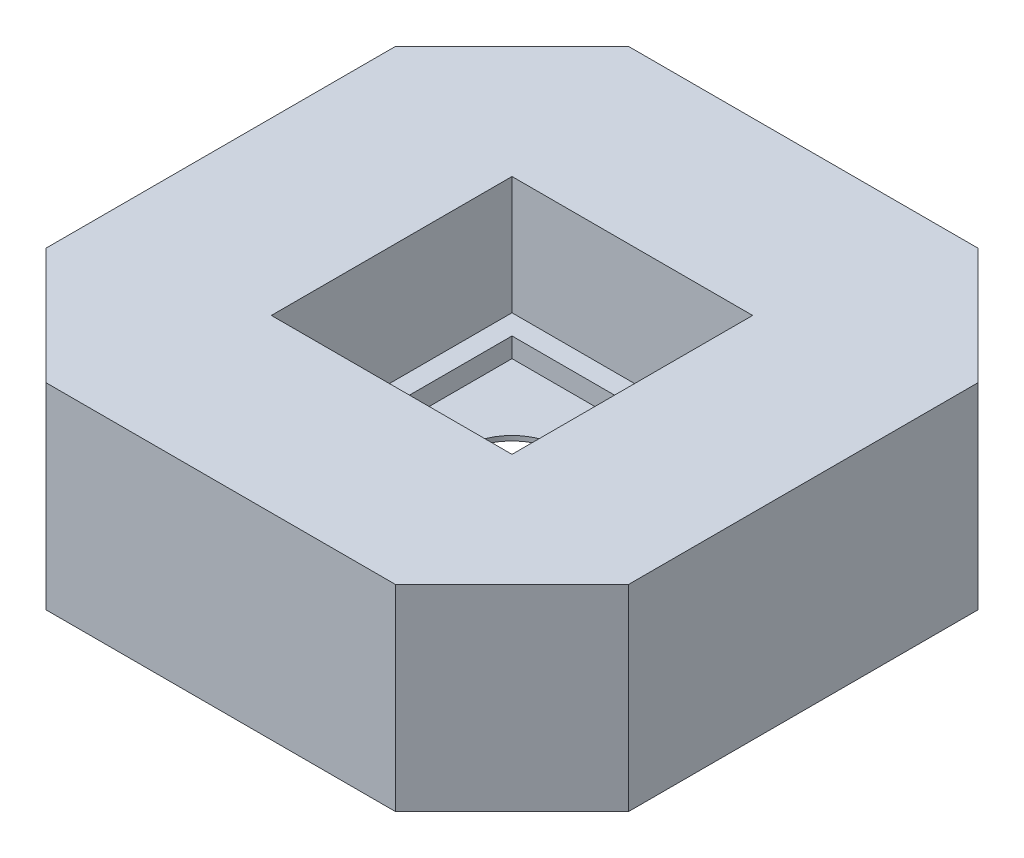
from build123d import *

# Parameters (mm, degrees)
EXTRUDE_1_DEPTH                    = 206
SKETCH_2_W                         = 252
SKETCH_2_H                         = 252
CUT_EXTRUDE_1_DEPTH                = 123.6
SKETCH_3_W                         = 210
SKETCH_3_H                         = 210
CUT_EXTRUDE_2_DEPTH                = 144.2
SHELL_1_T                          = -5
SKETCH_4_R                         = 50
CUT_EXTRUDE_3_DEPTH                = 455.80065963
RIB_1_REACH                        = 542.993
SKETCH_5_WALL_W                    = 1255.59277199
SKETCH_5_WALL_H                    = 10
PATTERN_CIRCULAR_1_COPY_1_REACH    = 542.993
PATTERN_CIRCULAR_1_COPY_1_SKETCH_W = 1255.59277199
PATTERN_CIRCULAR_1_COPY_1_SKETCH_H = 10
PATTERN_CIRCULAR_1_COPY_2_REACH    = 542.993
PATTERN_CIRCULAR_1_COPY_2_SKETCH_W = 1255.59277199
PATTERN_CIRCULAR_1_COPY_2_SKETCH_H = 10
PATTERN_CIRCULAR_1_COPY_3_REACH    = 542.993
PATTERN_CIRCULAR_1_COPY_3_SKETCH_W = 1255.59277199
PATTERN_CIRCULAR_1_COPY_3_SKETCH_H = 10
PATTERN_CIRCULAR_1_COPY_4_REACH    = 542.993
PATTERN_CIRCULAR_1_COPY_4_SKETCH_W = 1255.59277199
PATTERN_CIRCULAR_1_COPY_4_SKETCH_H = 10
PATTERN_CIRCULAR_1_COPY_5_REACH    = 542.993
PATTERN_CIRCULAR_1_COPY_5_SKETCH_W = 1255.59277199
PATTERN_CIRCULAR_1_COPY_5_SKETCH_H = 10
PATTERN_CIRCULAR_1_COPY_6_REACH    = 542.993
PATTERN_CIRCULAR_1_COPY_6_SKETCH_W = 1255.59277199
PATTERN_CIRCULAR_1_COPY_6_SKETCH_H = 10


with BuildPart() as part:
    # 草图1 → 凸台-拉伸1 (new body)
    with BuildSketch(Plane(origin=(0, 0, 0), x_dir=(1, 0, 0), z_dir=(0, 1, 0))):
        Polygon((-305, 183), (-183, 305), (183, 305), (305, 183), (305, -183), (183, -305), (-183, -305), (-305, -183), align=None)
    extrude(amount=EXTRUDE_1_DEPTH)

    # 草图2 → 切除-拉伸1 (cut)
    with BuildSketch(Plane(origin=(0, 206, 0), x_dir=(1, 0, 0), z_dir=(0, 1, 0))):
        Rectangle(SKETCH_2_W, SKETCH_2_H)
    extrude(amount=-CUT_EXTRUDE_1_DEPTH, mode=Mode.SUBTRACT)

    # 草图3 → 切除-拉伸2 (cut)
    with BuildSketch(Plane(origin=(0, 206, 0), x_dir=(1, 0, 0), z_dir=(0, 1, 0))):
        Rectangle(SKETCH_3_W, SKETCH_3_H)
    extrude(amount=-CUT_EXTRUDE_2_DEPTH, mode=Mode.SUBTRACT)

    # 抽壳1
    shell_1_openings = [part.faces().sort_by_distance(p)[0] for p in [
        (0, 0, 0),
    ]]
    offset(amount=SHELL_1_T, openings=shell_1_openings, kind=Kind.INTERSECTION)

    # 草图4 → 切除-拉伸3 (cut, through all)
    with BuildSketch(Plane(origin=(0, 61.8, 0), x_dir=(1, 0, 0), z_dir=(0, 1, 0))):
        Circle(SKETCH_4_R)
    extrude(amount=-CUT_EXTRUDE_3_DEPTH, mode=Mode.SUBTRACT)

    # 草图5 wall → 筋1 (add, up to next)
    with BuildSketch(Plane(origin=(-215.5, 97.29962987, 91.5), x_dir=(-0.984807753012, 0.173648177668, 0), z_dir=(-0.173648177668, -0.984807753012, 0)), mode=Mode.PRIVATE) as rib_1_sk1:
        Rectangle(SKETCH_5_WALL_W, SKETCH_5_WALL_H)
    rib_1_tool1 = extrude(rib_1_sk1.sketch, amount=-RIB_1_REACH, mode=Mode.PRIVATE) - part.part
    rib_1 = rib_1_tool1.solids().sort_by_distance((-215.5, 97.29962987, 91.5))[0]
    add(rib_1)

    # 镜向1: 筋1 across plane
    add(rib_1.mirror(Plane.XY))

    # 阵列(圆周)1 copy 1 sketch → 阵列(圆周)1 copy 1 (add, up to next)
    with BuildSketch(Plane(origin=(-91.5, 97.29962987, 215.5), x_dir=(0, 0.173648177668, 0.984807753012), z_dir=(0, -0.984807753012, 0.173648177668)), mode=Mode.PRIVATE) as pattern_circular_1_copy_1_sk1:
        Rectangle(PATTERN_CIRCULAR_1_COPY_1_SKETCH_W, PATTERN_CIRCULAR_1_COPY_1_SKETCH_H)
    pattern_circular_1_copy_1_tool1 = extrude(pattern_circular_1_copy_1_sk1.sketch, amount=-PATTERN_CIRCULAR_1_COPY_1_REACH, mode=Mode.PRIVATE) - part.part
    add(pattern_circular_1_copy_1_tool1.solids().sort_by_distance((-91.5, 97.29962987, 215.5))[0])

    # 阵列(圆周)1 copy 2 sketch → 阵列(圆周)1 copy 2 (add, up to next)
    with BuildSketch(Plane(origin=(215.5, 97.29962987, 91.5), x_dir=(0.984807753012, 0.173648177668, 0), z_dir=(0.173648177668, -0.984807753012, 0)), mode=Mode.PRIVATE) as pattern_circular_1_copy_2_sk1:
        Rectangle(PATTERN_CIRCULAR_1_COPY_2_SKETCH_W, PATTERN_CIRCULAR_1_COPY_2_SKETCH_H)
    pattern_circular_1_copy_2_tool1 = extrude(pattern_circular_1_copy_2_sk1.sketch, amount=-PATTERN_CIRCULAR_1_COPY_2_REACH, mode=Mode.PRIVATE) - part.part
    add(pattern_circular_1_copy_2_tool1.solids().sort_by_distance((215.5, 97.29962987, 91.5))[0])

    # 阵列(圆周)1 copy 3 sketch → 阵列(圆周)1 copy 3 (add, up to next)
    with BuildSketch(Plane(origin=(91.5, 97.29962987, -215.5), x_dir=(0, 0.173648177668, -0.984807753012), z_dir=(0, -0.984807753012, -0.173648177668)), mode=Mode.PRIVATE) as pattern_circular_1_copy_3_sk1:
        Rectangle(PATTERN_CIRCULAR_1_COPY_3_SKETCH_W, PATTERN_CIRCULAR_1_COPY_3_SKETCH_H)
    pattern_circular_1_copy_3_tool1 = extrude(pattern_circular_1_copy_3_sk1.sketch, amount=-PATTERN_CIRCULAR_1_COPY_3_REACH, mode=Mode.PRIVATE) - part.part
    add(pattern_circular_1_copy_3_tool1.solids().sort_by_distance((91.5, 97.29962987, -215.5))[0])

    # 阵列(圆周)1 copy 4 sketch → 阵列(圆周)1 copy 4 (add, up to next)
    with BuildSketch(Plane(origin=(91.5, 97.29962987, 215.5), x_dir=(0, 0.173648177668, 0.984807753012), z_dir=(0, -0.984807753012, 0.173648177668)), mode=Mode.PRIVATE) as pattern_circular_1_copy_4_sk1:
        Rectangle(PATTERN_CIRCULAR_1_COPY_4_SKETCH_W, PATTERN_CIRCULAR_1_COPY_4_SKETCH_H)
    pattern_circular_1_copy_4_tool1 = extrude(pattern_circular_1_copy_4_sk1.sketch, amount=-PATTERN_CIRCULAR_1_COPY_4_REACH, mode=Mode.PRIVATE) - part.part
    add(pattern_circular_1_copy_4_tool1.solids().sort_by_distance((91.5, 97.29962987, 215.5))[0])

    # 阵列(圆周)1 copy 5 sketch → 阵列(圆周)1 copy 5 (add, up to next)
    with BuildSketch(Plane(origin=(215.5, 97.29962987, -91.5), x_dir=(0.984807753012, 0.173648177668, 0), z_dir=(0.173648177668, -0.984807753012, 0)), mode=Mode.PRIVATE) as pattern_circular_1_copy_5_sk1:
        Rectangle(PATTERN_CIRCULAR_1_COPY_5_SKETCH_W, PATTERN_CIRCULAR_1_COPY_5_SKETCH_H)
    pattern_circular_1_copy_5_tool1 = extrude(pattern_circular_1_copy_5_sk1.sketch, amount=-PATTERN_CIRCULAR_1_COPY_5_REACH, mode=Mode.PRIVATE) - part.part
    add(pattern_circular_1_copy_5_tool1.solids().sort_by_distance((215.5, 97.29962987, -91.5))[0])

    # 阵列(圆周)1 copy 6 sketch → 阵列(圆周)1 copy 6 (add, up to next)
    with BuildSketch(Plane(origin=(-91.5, 97.29962987, -215.5), x_dir=(0, 0.173648177668, -0.984807753012), z_dir=(0, -0.984807753012, -0.173648177668)), mode=Mode.PRIVATE) as pattern_circular_1_copy_6_sk1:
        Rectangle(PATTERN_CIRCULAR_1_COPY_6_SKETCH_W, PATTERN_CIRCULAR_1_COPY_6_SKETCH_H)
    pattern_circular_1_copy_6_tool1 = extrude(pattern_circular_1_copy_6_sk1.sketch, amount=-PATTERN_CIRCULAR_1_COPY_6_REACH, mode=Mode.PRIVATE) - part.part
    add(pattern_circular_1_copy_6_tool1.solids().sort_by_distance((-91.5, 97.29962987, -215.5))[0])


solid = part.part
